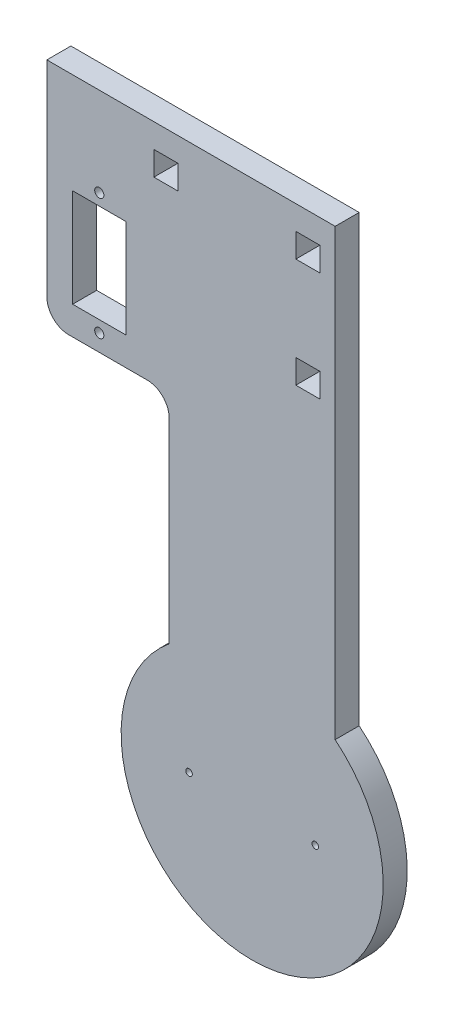
from build123d import *

# Parameters (mm, degrees)
EXTRUDE_1_DEPTH     = 5.5
SKETCH_2_W          = 12.2
SKETCH_2_H          = 22.5
CUT_EXTRUDE_1_DEPTH = 134.657210804
SKETCH_4_R          = 1.05
SKETCH_4_W          = 5.5
SKETCH_4_H          = 5.5
CUT_EXTRUDE_2_DEPTH = 134.657210804
FILLET_1_R          = 5
FILLET_2_R          = 5
SKETCH_5_R          = 0.75
CUT_EXTRUDE_3_DEPTH = 134.657210804


with BuildPart() as part:
    # ｽｹｯﾁ1 → ﾎﾞｽ - 押し出し1 (new body)
    with BuildSketch(Plane.XY):
        with BuildLine():
            Line((19, 125), (-47, 125))
            Line((-47, 125), (-47, 73))
            Line((-47, 73), (-19, 73))
            Line((-19, 73), (-19, 23.216373532))
            ThreePointArc((-19, 23.216373532), (0, -30), (19, 23.216373532))
            Line((19, 23.216373532), (19, 125))
        make_face()
    extrude(amount=EXTRUDE_1_DEPTH)

    # ｽｹｯﾁ2 → ｶｯﾄ - 押し出し1 (cut, through all)
    with BuildSketch(Plane.XY.offset(5.5)):
        with Locations((-35, 90.75)):
            Rectangle(SKETCH_2_W, SKETCH_2_H)
    extrude(amount=-CUT_EXTRUDE_1_DEPTH, mode=Mode.SUBTRACT)

    # ｽｹｯﾁ4 → ｶｯﾄ - 押し出し2 (cut, through all)
    with BuildSketch(Plane.XY.offset(5.5)):
        with Locations((-35, 104.65)):
            Circle(SKETCH_4_R)
        with Locations((-35, 76.85)):
            Circle(SKETCH_4_R)
        with Locations((12.75, 116.75)):
            Rectangle(SKETCH_4_W, SKETCH_4_H)
        with Locations((-19.75, 116.75)):
            Rectangle(SKETCH_4_W, SKETCH_4_H)
        with Locations((12.75, 91.75)):
            Rectangle(SKETCH_4_W, SKETCH_4_H)
    extrude(amount=-CUT_EXTRUDE_2_DEPTH, mode=Mode.SUBTRACT)

    # ﾌｨﾚｯﾄ1
    fillet_1_edges = [part.edges().sort_by_distance(p)[0] for p in [
        (-47, 73, 2.75),
    ]]
    fillet(fillet_1_edges, radius=FILLET_1_R)

    # ﾌｨﾚｯﾄ2
    fillet_2_edges = [part.edges().sort_by_distance(p)[0] for p in [
        (-19, 73, 2.75),
    ]]
    fillet(fillet_2_edges, radius=FILLET_2_R)

    # ｽｹｯﾁ5 → ｶｯﾄ - 押し出し3 (cut, through all)
    with BuildSketch(Plane.XY.offset(5.5)):
        with Locations((14.45, 0)):
            Circle(SKETCH_5_R)
        with Locations((-14.45, 0)):
            Circle(SKETCH_5_R)
    extrude(amount=-CUT_EXTRUDE_3_DEPTH, mode=Mode.SUBTRACT)


solid = part.part
